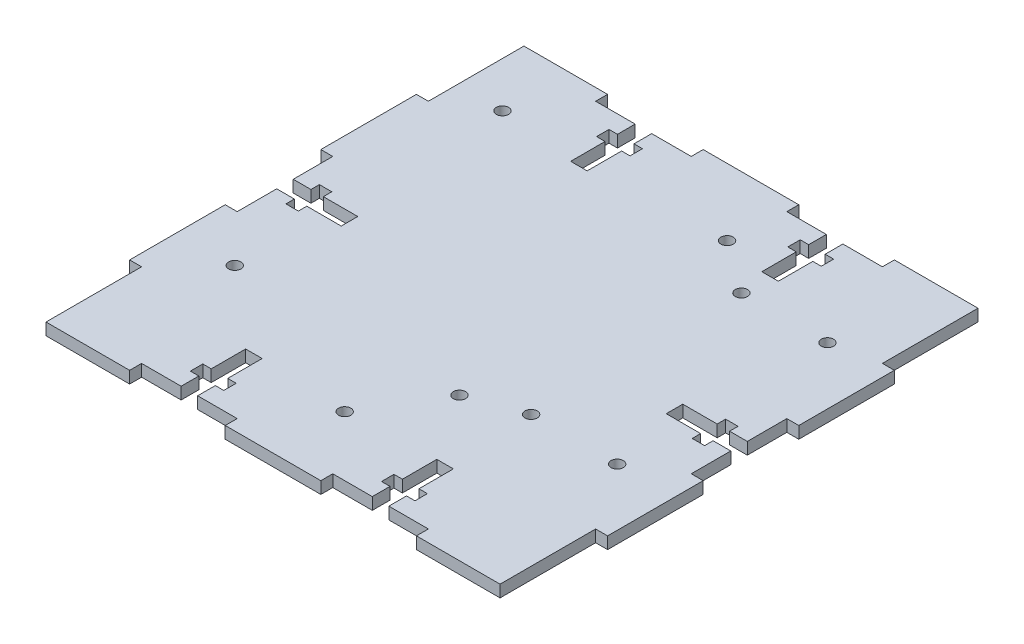
from build123d import *

# Parameters (mm, degrees)
SKETCH1_W                 = 127
SKETCH1_H                 = 127
BOSS_EXTRUDE1_DEPTH       = 3.175
SKETCH2_W                 = 3.175
SKETCH2_H                 = 25.4
CUT_EXTRUDE1_DEPTH        = 6.35
LPATTERN1_COUNT           = 3
LPATTERN1_PITCH           = 50.8
LPATTERN1_COUNT_DIR2      = 2
LPATTERN1_PITCH_DIR2      = 123.825
SKETCH3_W                 = 25.4
SKETCH3_H                 = 3.175
CUT_EXTRUDE2_DEPTH        = 6.35
LPATTERN2_COUNT           = 3
LPATTERN2_PITCH           = 50.8
LPATTERN2_COUNT_DIR2      = 2
LPATTERN2_PITCH_DIR2      = 123.825
SKETCH4_W                 = 17.145
SKETCH4_H                 = 4.3942
SKETCH4_W_2               = 3.302
SKETCH4_H_2               = 8.89
CUT_EXTRUDE3_DEPTH        = 8.89
SKETCH5_W                 = 4.3942
SKETCH5_H                 = 17.145
SKETCH5_W_2               = 8.89
SKETCH5_H_2               = 3.302
CUT_EXTRUDE4_DEPTH        = 30.48
LPATTERN3_COUNT           = 2
LPATTERN3_PITCH           = 50.8
MIRROR2_COPY_1_SKETCH_W   = 4.3942
MIRROR2_COPY_1_SKETCH_H   = 17.145
MIRROR2_COPY_1_SKETCH_W_2 = 8.89
MIRROR2_COPY_1_SKETCH_H_2 = 3.302
MIRROR2_COPY_1_DEPTH      = 30.48
MIRROR2_COPY_2_SKETCH_W   = 4.3942
MIRROR2_COPY_2_SKETCH_H   = 17.145
MIRROR2_COPY_2_SKETCH_W_2 = 8.89
MIRROR2_COPY_2_SKETCH_H_2 = 3.302
MIRROR2_COPY_2_DEPTH      = 30.48
F_4_CLEARANCE_HOLE4_D     = 3.2639
F_4_CLEARANCE_HOLE4_DEPTH = 10.16
F_4_CLEARANCE_HOLE4_TIP   = 0.980574487
F_4_CLEARANCE_HOLE5_D     = 3.2639
F_4_CLEARANCE_HOLE5_DEPTH = 10.16
F_4_CLEARANCE_HOLE5_TIP   = 0.980574487
F_4_CLEARANCE_HOLE6_D     = 3.2639
F_4_CLEARANCE_HOLE6_DEPTH = 10.16
F_4_CLEARANCE_HOLE6_TIP   = 0.980574487


with BuildPart() as part:
    # Sketch1 → Boss-Extrude1 (new body)
    with BuildSketch(Plane(origin=(0, 0, 0), x_dir=(1, 0, 0), z_dir=(0, 1, 0))):
        with Locations((63.5, 63.5)):
            Rectangle(SKETCH1_W, SKETCH1_H)
    extrude(amount=BOSS_EXTRUDE1_DEPTH)

    # Sketch2 → Cut-Extrude1 (cut)
    with BuildSketch(Plane(origin=(0, 3.175, 0), x_dir=(1, 0, 0), z_dir=(0, 1, 0))):
        with Locations((1.5875, 114.3)):
            Rectangle(SKETCH2_W, SKETCH2_H)
    cut_extrude1 = extrude(amount=-CUT_EXTRUDE1_DEPTH, mode=Mode.SUBTRACT)

    # LPattern1: Cut-Extrude1 3 × 2
    with Locations(*[(j * LPATTERN1_PITCH_DIR2, 0, i * LPATTERN1_PITCH) for i in range(LPATTERN1_COUNT) for j in range(LPATTERN1_COUNT_DIR2) if (i, j) != (0, 0)]):
        add(cut_extrude1, mode=Mode.SUBTRACT)

    # Sketch3 → Cut-Extrude2 (cut)
    with BuildSketch(Plane(origin=(0, 3.175, 0), x_dir=(1, 0, 0), z_dir=(0, 1, 0))):
        with Locations((38.1, 1.5875)):
            Rectangle(SKETCH3_W, SKETCH3_H)
    cut_extrude2 = extrude(amount=-CUT_EXTRUDE2_DEPTH, mode=Mode.SUBTRACT)

    # LPattern2: Cut-Extrude2 3 × 2
    with Locations(*[(i * LPATTERN2_PITCH, 0, -j * LPATTERN2_PITCH_DIR2) for i in range(LPATTERN2_COUNT) for j in range(LPATTERN2_COUNT_DIR2) if (i, j) != (0, 0)]):
        add(cut_extrude2, mode=Mode.SUBTRACT)

    # Sketch4 → Cut-Extrude3 (cut)
    with BuildSketch(Plane(origin=(0, 3.175, 0), x_dir=(1, 0, 0), z_dir=(0, 1, 0))):
        with Locations((115.2525, 63.5)):
            Rectangle(SKETCH4_W, SKETCH4_H)
        with Locations((117.475, 63.5)):
            Rectangle(SKETCH4_W_2, SKETCH4_H_2)
    cut_extrude3 = extrude(amount=-CUT_EXTRUDE3_DEPTH, mode=Mode.SUBTRACT)

    # Sketch5 → Cut-Extrude4 (cut)
    with BuildSketch(Plane(origin=(0, 3.175, 0), x_dir=(1, 0, 0), z_dir=(0, 1, 0))):
        with Locations((38.1, 11.7475)):
            Rectangle(SKETCH5_W, SKETCH5_H)
        with Locations((38.1, 9.525)):
            Rectangle(SKETCH5_W_2, SKETCH5_H_2)
    cut_extrude4 = extrude(amount=-CUT_EXTRUDE4_DEPTH, mode=Mode.SUBTRACT)

    # LPattern3: Cut-Extrude4 ×2
    with Locations(*[(i * LPATTERN3_PITCH, 0, 0) for i in range(1, LPATTERN3_COUNT)]):
        add(cut_extrude4, mode=Mode.SUBTRACT)

    # Mirror2 copy 1 sketch → Mirror2 copy 1 (cut)
    with BuildSketch(Plane(origin=(50.8, 3.175, -127), x_dir=(1, 0, 0), z_dir=(0, 1, 0))):
        with Locations((38.1, -11.7475)):
            Rectangle(MIRROR2_COPY_1_SKETCH_W, MIRROR2_COPY_1_SKETCH_H)
        with Locations((38.1, -9.525)):
            Rectangle(MIRROR2_COPY_1_SKETCH_W_2, MIRROR2_COPY_1_SKETCH_H_2)
    extrude(amount=-MIRROR2_COPY_1_DEPTH, mode=Mode.SUBTRACT)

    # Mirror2 copy 2 sketch → Mirror2 copy 2 (cut)
    with BuildSketch(Plane(origin=(0, 3.175, -127), x_dir=(1, 0, 0), z_dir=(0, 1, 0))):
        with Locations((38.1, -11.7475)):
            Rectangle(MIRROR2_COPY_2_SKETCH_W, MIRROR2_COPY_2_SKETCH_H)
        with Locations((38.1, -9.525)):
            Rectangle(MIRROR2_COPY_2_SKETCH_W_2, MIRROR2_COPY_2_SKETCH_H_2)
    extrude(amount=-MIRROR2_COPY_2_DEPTH, mode=Mode.SUBTRACT)

    # #4 Clearance Hole4
    with Locations(Plane(origin=(0, 3.175, 0), x_dir=(1, 0, 0), z_dir=(0, 1, 0))):
        with Locations((63.5, 19.05)):
            Hole(F_4_CLEARANCE_HOLE4_D / 2, depth=F_4_CLEARANCE_HOLE4_DEPTH)
            with Locations((0, 0, -(F_4_CLEARANCE_HOLE4_DEPTH + F_4_CLEARANCE_HOLE4_TIP / 2))):  # 118° drill point
                Cone(0, F_4_CLEARANCE_HOLE4_D / 2, F_4_CLEARANCE_HOLE4_TIP, mode=Mode.SUBTRACT)

    # Mirror3: Cut-Extrude3 across plane
    add(cut_extrude3.mirror(Plane.ZY.offset(-63.5)), mode=Mode.SUBTRACT)

    # #4 Clearance Hole5
    with Locations(Plane(origin=(0, 3.175, 0), x_dir=(1, 0, 0), z_dir=(0, 1, 0))):
        with Locations((15.24, 109.22), (74.93, 109.22), (74.93, 38.1), (15.24, 38.1)):
            Hole(F_4_CLEARANCE_HOLE5_D / 2, depth=F_4_CLEARANCE_HOLE5_DEPTH)
            with Locations((0, 0, -(F_4_CLEARANCE_HOLE5_DEPTH + F_4_CLEARANCE_HOLE5_TIP / 2))):  # 118° drill point
                Cone(0, F_4_CLEARANCE_HOLE5_D / 2, F_4_CLEARANCE_HOLE5_TIP, mode=Mode.SUBTRACT)

    # #4 Clearance Hole6
    with Locations(Plane(origin=(0, 3.175, 0), x_dir=(1, 0, 0), z_dir=(0, 1, 0))):
        with Locations((88.9, 99.06), (111.76, 99.06), (111.76, 43.18), (88.9, 43.18)):
            Hole(F_4_CLEARANCE_HOLE6_D / 2, depth=F_4_CLEARANCE_HOLE6_DEPTH)
            with Locations((0, 0, -(F_4_CLEARANCE_HOLE6_DEPTH + F_4_CLEARANCE_HOLE6_TIP / 2))):  # 118° drill point
                Cone(0, F_4_CLEARANCE_HOLE6_D / 2, F_4_CLEARANCE_HOLE6_TIP, mode=Mode.SUBTRACT)


solid = part.part
